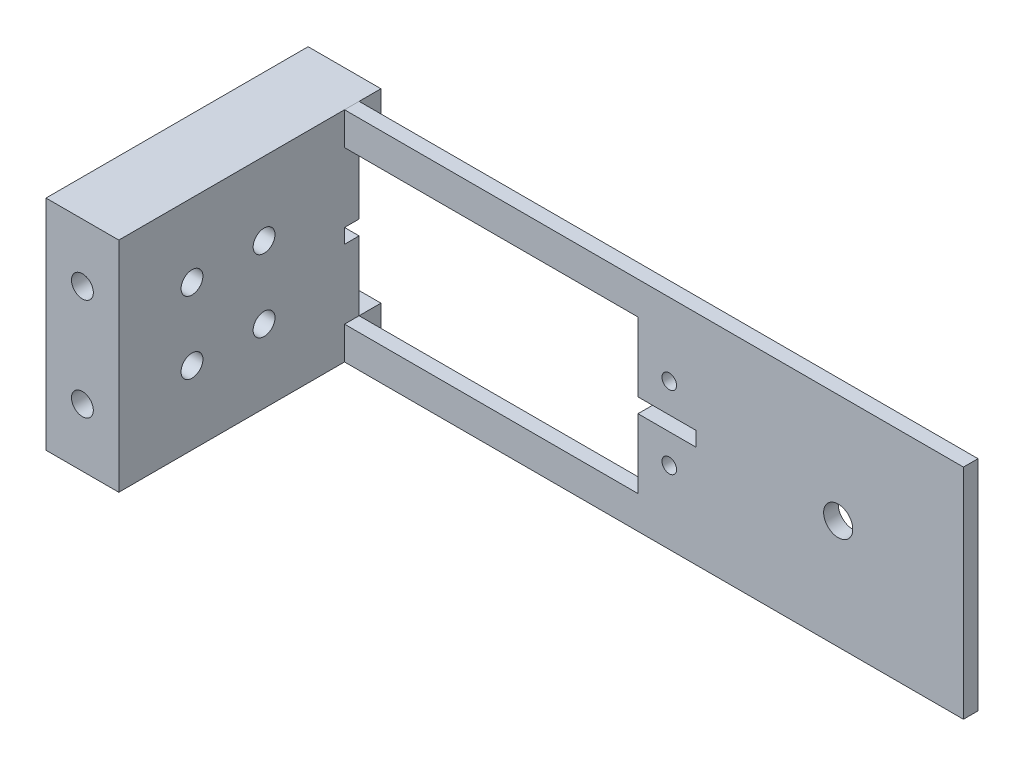
from build123d import *

# Parameters (mm, degrees)
EXTRUDE_1_DEPTH     = 30
SKETCH_2_R          = 1.5
CUT_EXTRUDE_1_DEPTH = 106.929221653
SKETCH_3_W          = 40.3
SKETCH_3_H          = 21
CUT_EXTRUDE_2_DEPTH = 106.929221653
SKETCH_4_W          = 8
SKETCH_4_H          = 21
CUT_EXTRUDE_3_DEPTH = 3
SKETCH_5_W          = 56.3
SKETCH_5_H          = 2
CUT_EXTRUDE_4_DEPTH = 5
SKETCH_6_R          = 1
CUT_EXTRUDE_5_DEPTH = 4
SKETCH_7_R          = 2
CUT_EXTRUDE_6_DEPTH = 106.929221653
SKETCH_8_R          = 1.5
CUT_EXTRUDE_7_DEPTH = 4


with BuildPart() as part:
    # Эскиз1 → Бобышка-Вытянуть1 (new body)
    with BuildSketch(Plane(origin=(0, 0, 0), x_dir=(1, 0, 0), z_dir=(0, 1, 0))):
        Polygon((0, 0), (10, 0), (10, 31), (95, 31), (95, 33), (10, 33), (10, 36), (0, 36), align=None)
    extrude(amount=EXTRUDE_1_DEPTH)

    # Эскиз2 → Вырез-Вытянуть1 (cut, through all)
    with BuildSketch(Plane.ZY):
        with Locations((-19.949747468, 19.949747468)):
            Circle(SKETCH_2_R)
        with Locations((-10.050252532, 19.949747468)):
            Circle(SKETCH_2_R)
        with Locations((-19.949747468, 10.050252532)):
            Circle(SKETCH_2_R)
        with Locations((-10.050252532, 10.050252532)):
            Circle(SKETCH_2_R)
    extrude(amount=-CUT_EXTRUDE_1_DEPTH, mode=Mode.SUBTRACT)

    # Эскиз3 → Вырез-Вытянуть2 (cut, through all)
    with BuildSketch(Plane(origin=(0, 0, -36), x_dir=(-1, 0, 0), z_dir=(0, 0, -1))):
        with Locations((-30.15, 15)):
            Rectangle(SKETCH_3_W, SKETCH_3_H)
    extrude(amount=-CUT_EXTRUDE_2_DEPTH, mode=Mode.SUBTRACT)

    # Эскиз4 → Вырез-Вытянуть3 (cut)
    with BuildSketch(Plane(origin=(0, 0, -36), x_dir=(-1, 0, 0), z_dir=(0, 0, -1))):
        with Locations((-6, 15)):
            Rectangle(SKETCH_4_W, SKETCH_4_H)
    extrude(amount=-CUT_EXTRUDE_3_DEPTH, mode=Mode.SUBTRACT)

    # Эскиз5 → Вырез-Вытянуть4 (cut)
    with BuildSketch(Plane(origin=(0, 0, -36), x_dir=(-1, 0, 0), z_dir=(0, 0, -1))):
        with Locations((-30.15, 15)):
            Rectangle(SKETCH_5_W, SKETCH_5_H)
    extrude(amount=-CUT_EXTRUDE_4_DEPTH, mode=Mode.SUBTRACT)

    # Эскиз6 → Вырез-Вытянуть5 (cut)
    with BuildSketch(Plane(origin=(0, 0, -33), x_dir=(-1, 0, 0), z_dir=(0, 0, -1))):
        with Locations((-5.4, 10)):
            Circle(SKETCH_6_R)
        with Locations((-54.6, 10)):
            Circle(SKETCH_6_R)
        with Locations((-5.4, 20)):
            Circle(SKETCH_6_R)
        with Locations((-54.6, 20)):
            Circle(SKETCH_6_R)
    extrude(amount=-CUT_EXTRUDE_5_DEPTH, mode=Mode.SUBTRACT)

    # Эскиз7 → Вырез-Вытянуть6 (cut, through all)
    with BuildSketch(Plane(origin=(0, 0, -36), x_dir=(-1, 0, 0), z_dir=(0, 0, -1))):
        with Locations((-77.8, 15)):
            Circle(SKETCH_7_R)
    extrude(amount=-CUT_EXTRUDE_6_DEPTH, mode=Mode.SUBTRACT)

    # Эскиз8 → Вырез-Вытянуть7 (cut)
    with BuildSketch(Plane.XY):
        with Locations((5, 22)):
            Circle(SKETCH_8_R)
        with Locations((5, 8)):
            Circle(SKETCH_8_R)
    extrude(amount=-CUT_EXTRUDE_7_DEPTH, mode=Mode.SUBTRACT)


with BuildPart() as body_2:
    # Split Bodies 1: the piece on the far side of the plane
    add(part.part)
    split(bisect_by=Plane(origin=(10, 30, 0), x_dir=(0, 0, -1), z_dir=(-1, 0, 0)), keep=Keep.BOTTOM)


with BuildPart() as part_1:
    add(part.part)

    # Split Bodies 1
    split(bisect_by=Plane(origin=(10, 30, 0), x_dir=(0, 0, -1), z_dir=(-1, 0, 0)), keep=Keep.TOP)


solid = Compound([body_2.part, part_1.part])
